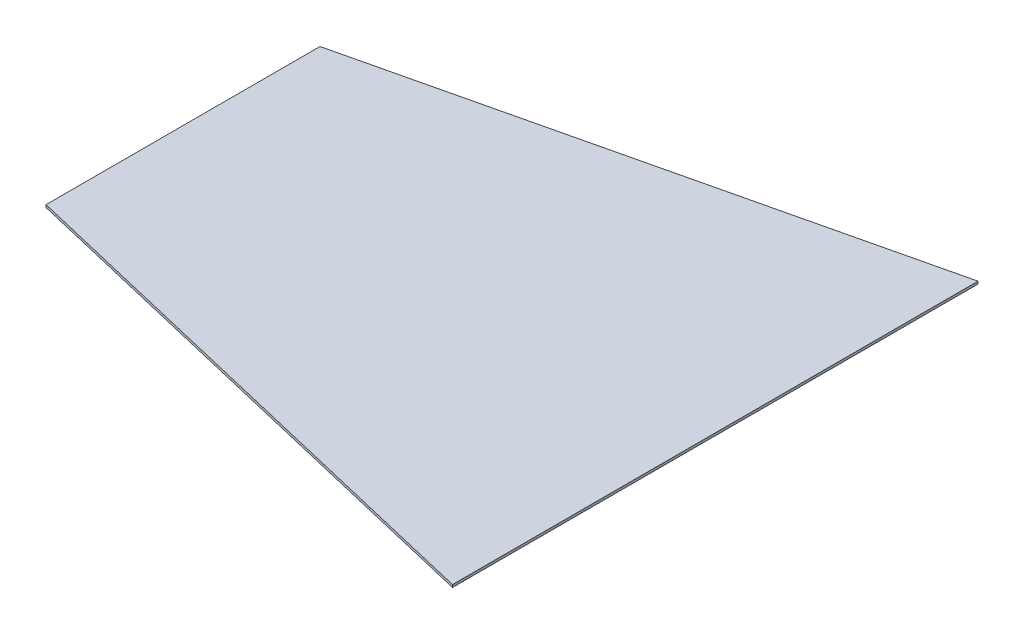
from build123d import *

# Parameters (mm, degrees)
SKETCH1_W           = 725.604694584
SKETCH1_H           = 528.32
BOSS_EXTRUDE1_DEPTH = 2.54
CUT_EXTRUDE1_DEPTH  = 2.54
CUT_EXTRUDE4_DEPTH  = 2.54


with BuildPart() as part:
    # Sketch1 → Boss-Extrude1 (new body)
    with BuildSketch(Plane(origin=(0, 0, 0), x_dir=(1, 0, 0), z_dir=(0, 1, 0))):
        with Locations((-66.389589318, -202.68532833)):
            Rectangle(SKETCH1_W, SKETCH1_H)
    extrude(amount=BOSS_EXTRUDE1_DEPTH)

    # Sketch2 → Cut-Extrude1 (cut)
    with BuildSketch(Plane(origin=(0, 2.54, 0), x_dir=(1, 0, 0), z_dir=(0, 1, 0))):
        Polygon((296.412757974, -466.84532833), (-429.19193661, -295.39532833), (-429.19193661, -466.84532833), align=None)
        Polygon((296.412757974, 61.47467167), (-429.19193661, -109.97532833), (-429.19193661, 61.47467167), align=None)
    extrude(amount=-CUT_EXTRUDE1_DEPTH, mode=Mode.SUBTRACT)

    # Sketch5 → Cut-Extrude4 (cut)
    with BuildSketch(Plane(origin=(0, 2.54, 0), x_dir=(1, 0, 0), z_dir=(0, 1, 0))):
        Polygon((-238.69193661, -64.962905941), (-429.19193661, -109.97532833), (-429.19193661, -295.39532833), (-238.69193661, -340.407750719), align=None)
    extrude(amount=-CUT_EXTRUDE4_DEPTH, mode=Mode.SUBTRACT)


solid = part.part
